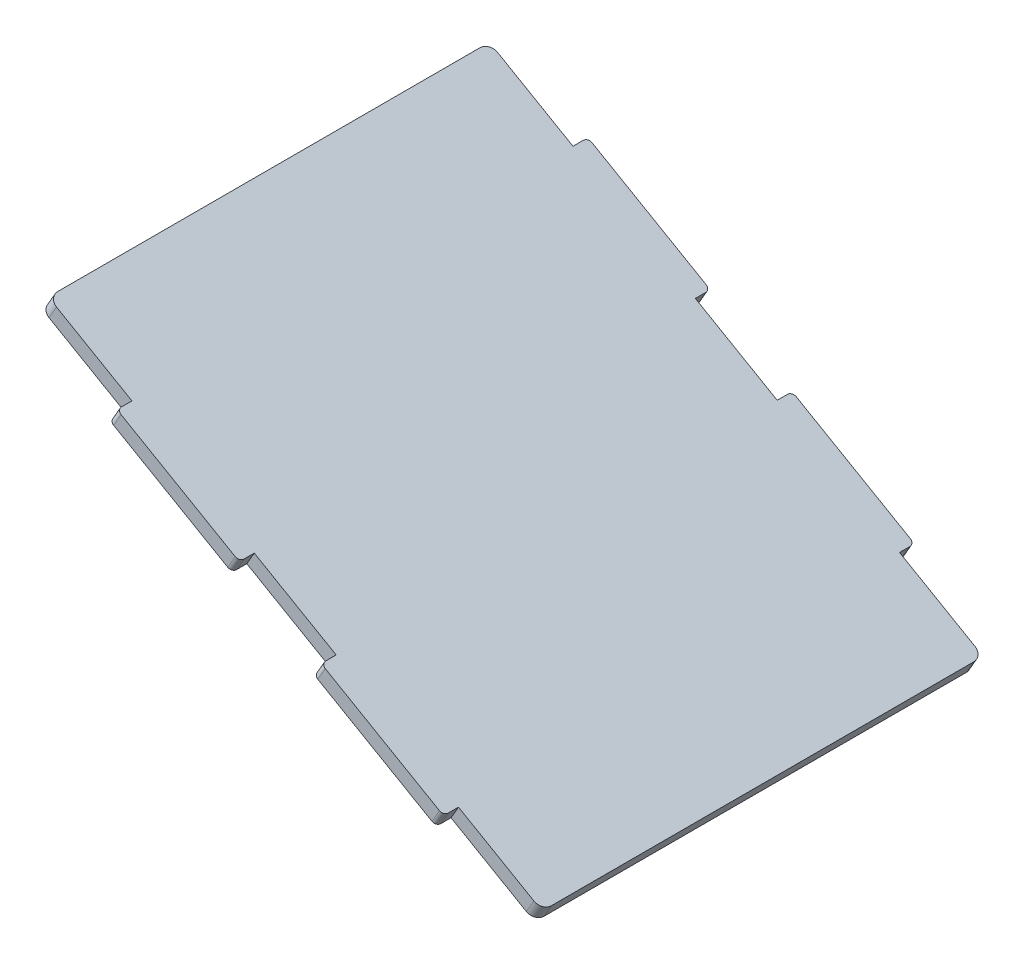
from build123d import *

# Parameters (mm, degrees)
EXTRUDE_THIN1_DEPTH = 100
CAVITY1_START       = -76.897726178
CAVITY1_OUTLINE_W   = 3.175
CAVITY1_OUTLINE_H   = 3.175
CAVITY1_DEPTH       = 20.486772374
CAVITY1_START_2     = 23.656985384
CAVITY1_2_OUTLINE_W = 3.175
CAVITY1_2_OUTLINE_H = 3.175
CAVITY1_2_DEPTH     = 20.486772374
CAVITY1_START_3     = -26.410953804
CAVITY1_3_OUTLINE_W = 3.175
CAVITY1_3_OUTLINE_H = 3.175
CAVITY1_3_DEPTH     = 20.067939188
FILLET1_R           = 2
FILLET2_R           = 1


# Read off the part's stored shape, not the designer's step: Cavity1
with BuildPart() as part:
    # Sketch1 → Extrude-Thin1 (new body)
    with BuildSketch(Plane.XY.offset(1.5875)):
        Polygon((-89.533643617, -1.281367376), (15.291356383, -61.802109344), (16.878856383, -59.052478687), (-87.946143617, 1.468263281), align=None)
    extrude(amount=-EXTRUDE_THIN1_DEPTH)

    # Cavity1 outline → Cavity1 (cut)
    with BuildSketch(Plane(origin=(0, 0, 0), x_dir=(0.5000000000000022, 0.8660254037844374, 0), z_dir=(0.8660254037844374, -0.5000000000000022, 0)).offset(CAVITY1_START)):
        with Locations((-44.289018508, -96.825)):
            Rectangle(CAVITY1_OUTLINE_W, CAVITY1_OUTLINE_H)
        with Locations((-44.289018508, 0)):
            Rectangle(CAVITY1_OUTLINE_W, CAVITY1_OUTLINE_H)
    extrude(amount=CAVITY1_DEPTH, mode=Mode.SUBTRACT)

    # Cavity1 2 outline → Cavity1 2 (cut)
    with BuildSketch(Plane(origin=(0, 0, 0), x_dir=(0.5000000000000022, 0.8660254037844374, 0), z_dir=(0.8660254037844374, -0.5000000000000022, 0)).offset(CAVITY1_START_2)):
        with Locations((-44.289018508, -96.825)):
            Rectangle(CAVITY1_2_OUTLINE_W, CAVITY1_2_OUTLINE_H)
        with Locations((-44.289018508, 0)):
            Rectangle(CAVITY1_2_OUTLINE_W, CAVITY1_2_OUTLINE_H)
    extrude(amount=CAVITY1_2_DEPTH, mode=Mode.SUBTRACT)

    # Cavity1 3 outline → Cavity1 3 (cut)
    with BuildSketch(Plane(origin=(0, 0, 0), x_dir=(0.5000000000000022, 0.8660254037844374, 0), z_dir=(0.8660254037844374, -0.5000000000000022, 0)).offset(CAVITY1_START_3)):
        with Locations((-44.289018508, -96.825)):
            Rectangle(CAVITY1_3_OUTLINE_W, CAVITY1_3_OUTLINE_H)
        with Locations((-44.289018508, 0)):
            Rectangle(CAVITY1_3_OUTLINE_W, CAVITY1_3_OUTLINE_H)
    extrude(amount=CAVITY1_3_DEPTH, mode=Mode.SUBTRACT)

    # Fillet1
    fillet1_edges = [part.edges().sort_by_distance(p)[0] for p in [
        (-88.739893617, 0.093447952, -1.5875),
        (16.085106383, -60.427294016, -1.5875),
        (16.085106383, -60.427294016, -95.2375),
        (-88.739893617, 0.093447952, -95.2375),
    ]]
    fillet(fillet1_edges, radius=FILLET1_R)

    # Fillet2
    fillet2_edges = [part.edges().sort_by_distance(p)[0] for p in [
        (-27.637721048, -35.183907829, -98.4125),
        (-1.656958934, -50.183907829, -98.4125),
        (-45.017066186, -25.149938235, -98.4125),
        (-70.9978283, -10.149938235, -98.4125),
        (-27.637721048, -35.183907829, 1.5875),
        (-45.017066186, -25.149938235, 1.5875),
        (-1.656958934, -50.183907829, 1.5875),
        (-70.9978283, -10.149938235, 1.5875),
    ]]
    fillet(fillet2_edges, radius=FILLET2_R)


solid = part.part
